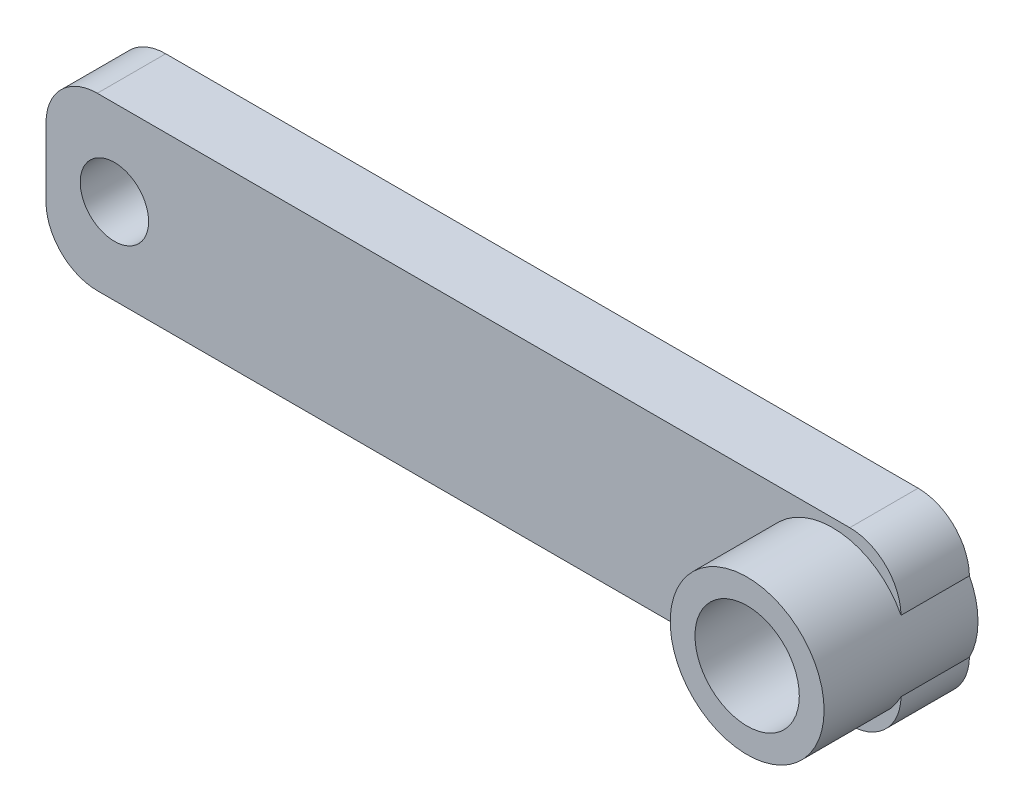
from build123d import *

# Parameters (mm, degrees)
SKETCH_1_W           = 50
SKETCH_1_H           = 10
SKETCH_1_R           = 3.05
SKETCH_1_R_2         = 2
EXTRUDE_1_DEPTH      = 4
EXTRUDE_2_DEPTH      = 5
EXTRUDE_2_DEPTH_BACK = 4
SKETCH_2_R           = 4.5
SKETCH_2_R_2         = 3.05
FILLET_1_R           = 3


with BuildPart() as part:
    # 草图1 → 凸台-拉伸1 (new body)
    with BuildSketch(Plane.XY):
        Rectangle(SKETCH_1_W, SKETCH_1_H)
        with Locations((21, 0)):
            Circle(SKETCH_1_R, mode=Mode.SUBTRACT)
        with Locations((-21, 0)):
            Circle(SKETCH_1_R_2, mode=Mode.SUBTRACT)
    extrude(amount=EXTRUDE_1_DEPTH)

    # 草图2 → 凸台-拉伸2 (add, two sides: drawn at the far end of the back side and taken through both)
    with BuildSketch(Plane.XY.offset(4).offset(-EXTRUDE_2_DEPTH_BACK)):
        with Locations((21, 0)):
            Circle(SKETCH_2_R)
        with Locations((21, 0)):
            Circle(SKETCH_2_R_2, mode=Mode.SUBTRACT)
    extrude(amount=EXTRUDE_2_DEPTH + EXTRUDE_2_DEPTH_BACK)

    # 圆角1
    # the kernel refuses this fillet: 3 mm, written as the material it takes off along each edge
    with BuildSketch(Plane(origin=(25, -5, -7.5), x_dir=(-1, 0, 0), z_dir=(0, 0, 1))) as fillet_1_piece_1_section:
        with BuildLine():
            CenterArc((FILLET_1_R, -FILLET_1_R), FILLET_1_R, 90, 90)
            Line((0, -FILLET_1_R), (0, 0))
            Line((0, 0), (FILLET_1_R, 0))
        make_face()
    fillet_1_piece_1 = extrude(amount=19, mode=Mode.PRIVATE)
    fillet_1_piece_1 = fillet_1_piece_1 - Plane(origin=(21, 0, 2), x_dir=(1, 0, 0), z_dir=(0, 0, 1)) * Cylinder(4.5, 50, mode=Mode.PRIVATE)
    add(fillet_1_piece_1, mode=Mode.SUBTRACT)
    with BuildSketch(Plane(origin=(25, 5, -7.5), x_dir=(-1, 0, 0), z_dir=(0, 0, 1))) as fillet_1_piece_2_section:
        with BuildLine():
            CenterArc((FILLET_1_R, FILLET_1_R), FILLET_1_R, 180, 90)
            Line((0, FILLET_1_R), (0, 0))
            Line((0, 0), (FILLET_1_R, 0))
        make_face()
    fillet_1_piece_2 = extrude(amount=19, mode=Mode.PRIVATE)
    fillet_1_piece_2 = fillet_1_piece_2 - Plane(origin=(21, 0, 2), x_dir=(1, 0, 0), z_dir=(0, 0, 1)) * Cylinder(4.5, 50, mode=Mode.PRIVATE)
    add(fillet_1_piece_2, mode=Mode.SUBTRACT)
    with BuildSketch(Plane(origin=(-25, -5, -7.5), x_dir=(0, 1, 0), z_dir=(0, 0, 1)), Plane(origin=(-25, 5, -7.5), x_dir=(1, 0, 0), z_dir=(0, 0, 1))) as fillet_1_piece_3:
        with BuildLine():
            CenterArc((FILLET_1_R, -FILLET_1_R), FILLET_1_R, 90, 90)
            Line((0, -FILLET_1_R), (0, 0))
            Line((0, 0), (FILLET_1_R, 0))
        make_face()
    extrude(amount=19, mode=Mode.SUBTRACT)


solid = part.part
